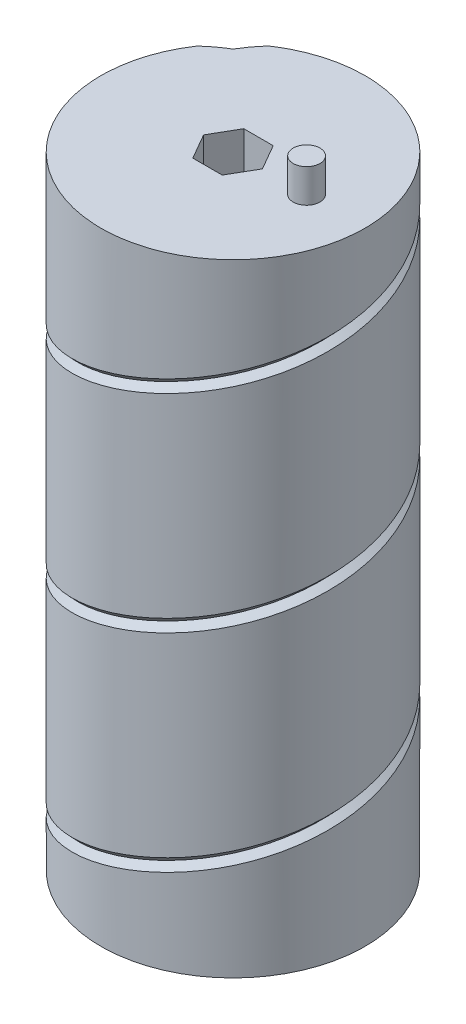
from build123d import *

# Parameters (mm, degrees)
SKETCH1_2_R                  = 19.75
EXTRUDE_MAIN_BODY_DEPTH      = 93
CUT_ANTENNA_WIRE_GUIDE_PITCH = 31
F_8_CLEARANCE_HOLE1_D        = 4.4958
SKETCH29_R                   = 2
EXTRUDED_PEG_DEPTH           = 5
CUT_EXTRUDE7_DEPTH           = 26.67
SKETCH43_R                   = 2.25
CUT_EXTRUDE8_DEPTH           = 5.5
CUT_EXTRUDE9_DEPTH           = 5


with BuildPart() as part:
    # Sketch1<2> → Extrude - Main Body (new body)
    with BuildSketch(Plane(origin=(0, 0, 0), x_dir=(1, 0, 0), z_dir=(0, 1, 0))):
        with Locations(Location((0, 0, 0), (0, 0, 90))):
            Circle(SKETCH1_2_R)
    extrude(amount=EXTRUDE_MAIN_BODY_DEPTH)

    # Cut - Antenna Wire Guide: arcs per turn and ends read off the stored shape
    # Cut - Antenna Wire Guide: the profile of Sketch15 screwed along a right-hand helix through 4.5 turns, 24 arcs to a turn; built about Z, then put on its axis
    cut_antenna_wire_guide_z = Axis((0, 0, 0), (0, 0, 1))
    cut_antenna_wire_guide_corners = [(19.75, 0, -31), (19.75, 0.222791045, -31.891831907), (18.830761184, 0, -31), (19.75, -0.222791045, -30.108168093)]
    with BuildLine(mode=Mode.PRIVATE) as cut_antenna_wire_guide_profile:
        Line(cut_antenna_wire_guide_corners[0], cut_antenna_wire_guide_corners[1])
        Line(cut_antenna_wire_guide_corners[1], cut_antenna_wire_guide_corners[2])
        Line(cut_antenna_wire_guide_corners[2], cut_antenna_wire_guide_corners[3])
        Line(cut_antenna_wire_guide_corners[3], cut_antenna_wire_guide_corners[0])
    cut_antenna_wire_guide_cap = Face(cut_antenna_wire_guide_profile.wire())
    cut_antenna_wire_guide_turn_angles = [0, 7.5, 15, 22.5, 30, 37.5, 45, 52.5, 60, 67.5, 75, 82.5, 90, 97.5, 105, 112.5, 120, 127.5, 135, 142.5, 150, 157.5, 165, 172.5, 180, 187.5, 195, 202.5, 210, 217.5, 225, 232.5, 240, 247.5, 255, 262.5, 270, 277.5, 285, 292.5, 300, 307.5, 315, 322.5, 330, 337.5, 345, 352.5, 360]
    cut_antenna_wire_guide_turn_weights = [1, 0.9914448613738104, 1, 0.9914448613738104, 1, 0.9914448613738104, 1, 0.9914448613738104, 1, 0.9914448613738104, 1, 0.9914448613738104, 1, 0.9914448613738104, 1, 0.9914448613738104, 1, 0.9914448613738104, 1, 0.9914448613738104, 1, 0.9914448613738104, 1, 0.9914448613738104, 1, 0.9914448613738104, 1, 0.9914448613738104, 1, 0.9914448613738104, 1, 0.9914448613738104, 1, 0.9914448613738104, 1, 0.9914448613738104, 1, 0.9914448613738104, 1, 0.9914448613738104, 1, 0.9914448613738104, 1, 0.9914448613738104, 1, 0.9914448613738104, 1, 0.9914448613738104, 1]
    cut_antenna_wire_guide_turn_rails = [Edge.make_bspline([Vector(p[0], p[1], 0).rotate(cut_antenna_wire_guide_z, cut_antenna_wire_guide_turn_angles[k]) / cut_antenna_wire_guide_turn_weights[k] + Vector(0, 0, p[2] + CUT_ANTENNA_WIRE_GUIDE_PITCH * cut_antenna_wire_guide_turn_angles[k] / 360) for k in range(49)], [0, 0, 0, 1, 1, 2, 2, 3, 3, 4, 4, 5, 5, 6, 6, 7, 7, 8, 8, 9, 9, 10, 10, 11, 11, 12, 12, 13, 13, 14, 14, 15, 15, 16, 16, 17, 17, 18, 18, 19, 19, 20, 20, 21, 21, 22, 22, 23, 23, 24, 24, 24], 2, cut_antenna_wire_guide_turn_weights) for p in cut_antenna_wire_guide_corners]
    cut_antenna_wire_guide_turn_sides = [Face.make_surface_from_curves(cut_antenna_wire_guide_turn_rails[p[0]], cut_antenna_wire_guide_turn_rails[p[1]]) for p in [(0, 1), (1, 2), (2, 3), (3, 0)]]
    cut_antenna_wire_guide_last_angles = [1440, 1447.5, 1455, 1462.5, 1470, 1477.5, 1485, 1492.5, 1500, 1507.5, 1515, 1522.5, 1530, 1537.5, 1545, 1552.5, 1560, 1567.5, 1575, 1582.5, 1590, 1597.5, 1605, 1612.5, 1620]
    cut_antenna_wire_guide_last_weights = [1, 0.9914448613738104, 1, 0.9914448613738104, 1, 0.9914448613738104, 1, 0.9914448613738104, 1, 0.9914448613738104, 1, 0.9914448613738104, 1, 0.9914448613738104, 1, 0.9914448613738104, 1, 0.9914448613738104, 1, 0.9914448613738104, 1, 0.9914448613738104, 1, 0.9914448613738104, 1]
    cut_antenna_wire_guide_last_rails = [Edge.make_bspline([Vector(p[0], p[1], 0).rotate(cut_antenna_wire_guide_z, cut_antenna_wire_guide_last_angles[k]) / cut_antenna_wire_guide_last_weights[k] + Vector(0, 0, p[2] + CUT_ANTENNA_WIRE_GUIDE_PITCH * cut_antenna_wire_guide_last_angles[k] / 360) for k in range(25)], [0, 0, 0, 1, 1, 2, 2, 3, 3, 4, 4, 5, 5, 6, 6, 7, 7, 8, 8, 9, 9, 10, 10, 11, 11, 12, 12, 12], 2, cut_antenna_wire_guide_last_weights) for p in cut_antenna_wire_guide_corners]
    cut_antenna_wire_guide_last_sides = [Face.make_surface_from_curves(cut_antenna_wire_guide_last_rails[p[0]], cut_antenna_wire_guide_last_rails[p[1]]) for p in [(0, 1), (1, 2), (2, 3), (3, 0)]]
    cut_antenna_wire_guide = Plane(origin=(0, 0, 0), x_dir=(-0.7071067811865537, 0, -0.7071067811865414), z_dir=(0, 1, 0)) * Solid(Shell([*[p.moved(Location((0, 0, CUT_ANTENNA_WIRE_GUIDE_PITCH * i))) for i in range(4) for p in cut_antenna_wire_guide_turn_sides], *cut_antenna_wire_guide_last_sides, cut_antenna_wire_guide_cap, cut_antenna_wire_guide_cap.rotate(cut_antenna_wire_guide_z, 1620).moved(Location((0, 0, CUT_ANTENNA_WIRE_GUIDE_PITCH * 1620 / 360)))]))
    add(cut_antenna_wire_guide, mode=Mode.SUBTRACT)

    # #8 Clearance Hole1 (through all)
    with Locations(Plane(origin=(0, 93, 0), x_dir=(1, 0, 0), z_dir=(0, 1, 0))):
        with Locations((0, 0)):
            Hole(F_8_CLEARANCE_HOLE1_D / 2)

    # Sketch29 → Extruded Peg (add)
    with BuildSketch(Plane(origin=(0, 93, 0), x_dir=(1, 0, 0), z_dir=(0, 1, 0))):
        with Locations(Location((11, 0, 0), (0, 0, 270))):
            Circle(SKETCH29_R)
    extrude(amount=EXTRUDED_PEG_DEPTH)

    # Sketch42 → Cut-Extrude7 (cut)
    with BuildSketch(Plane(origin=(0, 93, 0), x_dir=(1, 0, 0), z_dir=(0, 1, 0))):
        Polygon((-2.199704526, -3.81), (2.199704526, -3.81), (4.399409051, 0), (2.199704526, 3.81), (-2.199704526, 3.81), (-4.399409051, 0), align=None)
    extrude(amount=-CUT_EXTRUDE7_DEPTH, mode=Mode.SUBTRACT)

    # Sketch43 → Cut-Extrude8 (cut)
    with BuildSketch(Plane.XZ):
        with Locations(Location((11, 0, 0), (0, 0, 270))):
            Circle(SKETCH43_R)
    extrude(amount=-CUT_EXTRUDE8_DEPTH, mode=Mode.SUBTRACT)

    # Sketch44 → Cut-Extrude9 (cut)
    with BuildSketch(Plane(origin=(-19.75, 93, 0), x_dir=(0, 0, 1), z_dir=(-1, 0, 0))):
        with BuildLine():
            Line((-2.333333333, -37.076923077), (-3.230769231, -37.076923077))
            add(Edge.make_bspline(
                [(-3.230769231, -37.076923077), (-3.224920222, -36.957863398), (-3.213432925, -36.724033356), (-3.159637813, -36.383107909), (-3.082663878, -36.057237056), (-2.973831152, -35.749037301), (-2.838670359, -35.455783566), (-2.676584566, -35.178640664), (-2.484602136, -34.91866584), (-2.26686861, -34.678269144), (-2.030386784, -34.457733228), (-1.775226957, -34.267289677), (-1.507098308, -34.106382045), (-1.226814311, -33.971864211), (-0.931212701, -33.870893222), (-0.622975964, -33.795974252), (-0.30074986, -33.750898979), (-0.08120694, -33.746053877), (0.030448718, -33.743589744)],
                knots=[0, 0, 0, 0, 1.10065271, 2.161652631, 3.183658789, 4.190468796, 5.17591951, 6.163126047, 7.15150782, 8.156236427, 9.156009102, 10.134482811, 11.092018607, 12.041330605, 13.001268258, 13.972401359, 14.968799086, 16, 16, 16, 16], degree=3))
            add(Edge.make_bspline(
                [(0.030448718, -33.743589744), (0.140100358, -33.746156762), (0.355561914, -33.751200861), (0.670024813, -33.794518088), (0.969388511, -33.862362636), (1.253067844, -33.957549539), (1.518799457, -34.085505046), (1.768579585, -34.239212299), (2.005381901, -34.416983246), (2.21854414, -34.626279856), (2.414281509, -34.84971524), (2.583145095, -35.088252108), (2.727754134, -35.334621495), (2.848290362, -35.590702071), (2.937022188, -35.85890501), (3.004388496, -36.135325589), (3.042466821, -36.422825049), (3.048310888, -36.617415208), (3.051282051, -36.716346154)],
                knots=[0, 0, 0, 0, 1.111607364, 2.184268762, 3.212621178, 4.221274766, 5.211760367, 6.196651075, 7.1921475, 8.207485113, 9.220403448, 10.201281604, 11.166441695, 12.114753415, 13.065576456, 14.026450734, 14.996634279, 16, 16, 16, 16], degree=3))
            add(Edge.make_bspline(
                [(3.051282051, -36.716346154), (3.046444157, -36.855625681), (3.036853268, -37.131740577), (2.954812192, -37.537497328), (2.826679303, -37.930621383), (2.672401141, -38.247013674), (2.516765586, -38.501966514), (2.376515565, -38.711877099), (2.21233039, -38.937892723), (2.021820396, -39.179256544), (1.808926476, -39.43785913), (1.571720295, -39.71354426), (1.308510346, -40.003463602), (1.123771772, -40.201479606), (1.028044872, -40.304086538)],
                knots=[0, 0, 0, 0, 1.184426356, 2.348067706, 3.509069118, 4.696110526, 5.333549288, 6.050745305, 6.844228056, 7.710549037, 8.667450064, 9.695053472, 10.805634456, 12, 12, 12, 12], degree=3))
            Line((1.028044872, -40.304086538), (-1.473958333, -42.974358974))
            Line((-1.473958333, -42.974358974), (3.179487179, -42.974358974))
            Line((3.179487179, -42.974358974), (3.179487179, -44))
            Line((3.179487179, -44), (-3.615384615, -44))
            Line((-3.615384615, -44), (0.262820513, -39.861378205))
            add(Edge.make_bspline(
                [(0.262820513, -39.861378205), (0.357243047, -39.762811615), (0.53860941, -39.573485368), (0.795131058, -39.29707691), (1.025528167, -39.040649651), (1.231292147, -38.804688084), (1.407959305, -38.585740747), (1.56473711, -38.390898737), (1.690353085, -38.211600307), (1.826682787, -38.003769982), (1.958722733, -37.750020504), (2.072186608, -37.439924249), (2.141371889, -37.120703527), (2.149671419, -36.904983422), (2.153846154, -36.796474359)],
                knots=[0, 0, 0, 0, 1.329631726, 2.553950428, 3.673215718, 4.687767853, 5.603093632, 6.413772471, 7.123043292, 7.734684054, 8.834405432, 9.900288307, 10.943827018, 12, 12, 12, 12], degree=3))
            add(Edge.make_bspline(
                [(2.153846154, -36.796474359), (2.152029747, -36.728241792), (2.148449959, -36.593768505), (2.116856537, -36.396609194), (2.069112234, -36.206424012), (2.000697211, -36.022627957), (1.91039224, -35.847068951), (1.800468297, -35.679533293), (1.673639544, -35.517564821), (1.526921632, -35.365698255), (1.365745861, -35.226609097), (1.195476577, -35.103397424), (1.015333421, -35.000428536), (0.82607593, -34.916018544), (0.628231731, -34.849803169), (0.421418174, -34.803921514), (0.206206699, -34.775114417), (0.059253854, -34.771216783), (-0.015625, -34.769230769)],
                knots=[0, 0, 0, 0, 0.991446411, 1.95395049, 2.89581595, 3.838931463, 4.798493298, 5.75982156, 6.748411868, 7.785213223, 8.824556874, 9.840280684, 10.836137867, 11.835679398, 12.848801643, 13.863922112, 14.911575587, 16, 16, 16, 16], degree=3))
            add(Edge.make_bspline(
                [(-0.015625, -34.769230769), (-0.093827379, -34.771273719), (-0.24740394, -34.775285734), (-0.472886891, -34.803350488), (-0.687989113, -34.851767175), (-0.893251693, -34.917986245), (-1.089021938, -35.002153527), (-1.274347778, -35.106987083), (-1.448813176, -35.232082778), (-1.6127461, -35.373912939), (-1.76378604, -35.531820371), (-1.896491399, -35.707848837), (-2.012445725, -35.898784309), (-2.113614964, -36.104111597), (-2.195774079, -36.325693825), (-2.258554508, -36.56274441), (-2.308231213, -36.814234072), (-2.324826986, -36.987905743), (-2.333333333, -37.076923077)],
                knots=[0, 0, 0, 0, 1.031018746, 2.02475058, 2.990194455, 3.934040569, 4.864654155, 5.795059489, 6.735614925, 7.690564532, 8.649604399, 9.611025574, 10.590972636, 11.591080095, 12.624614302, 13.701020113, 14.821632451, 16, 16, 16, 16], degree=3))
        make_face()
    extrude(amount=-CUT_EXTRUDE9_DEPTH, mode=Mode.SUBTRACT)


solid = part.part
